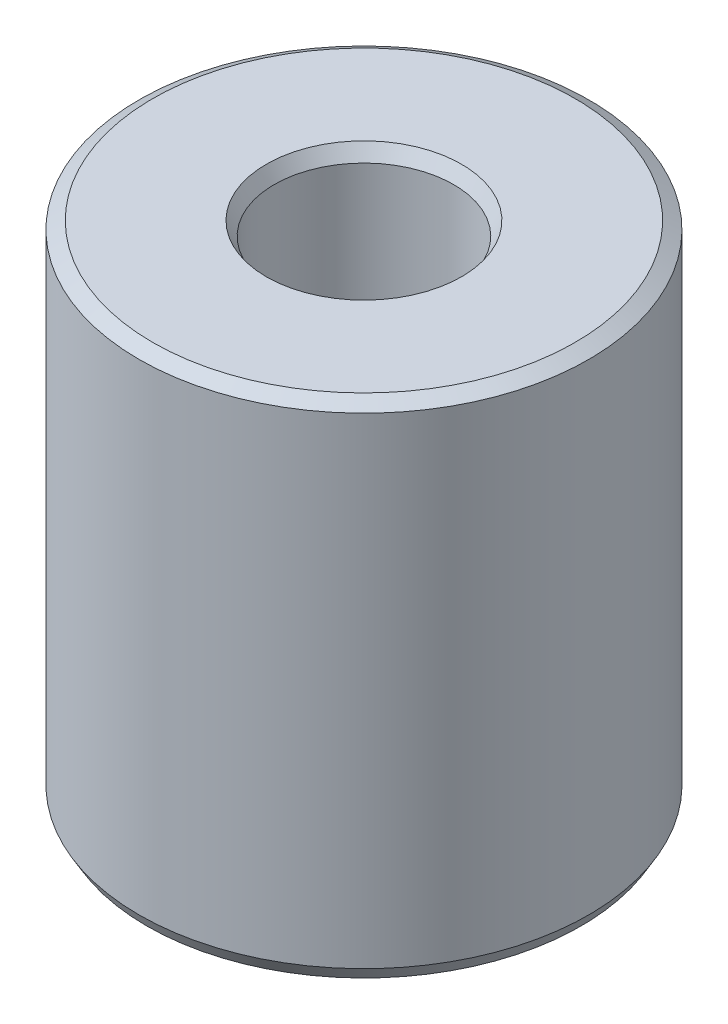
from build123d import *
from OCP.BRepFilletAPI import BRepFilletAPI_MakeChamfer

# Parameters (mm, degrees)
SKETCH1_R           = 57.5
BOSS_EXTRUDE1_DEPTH = 128.516499361
SKETCH2_R           = 22.933514178
CUT_EXTRUDE1_DEPTH  = 153.08218373
CHAMFER1_SIZE       = 2.01628121
CHAMFER1_SIZE2      = 3.492301499


with BuildPart() as part:
    # Sketch1 → Boss-Extrude1 (new body)
    with BuildSketch(Plane(origin=(0, 0, 0), x_dir=(1, 0, 0), z_dir=(0, 1, 0))):
        Circle(SKETCH1_R)
    extrude(amount=BOSS_EXTRUDE1_DEPTH)

    # Sketch2 → Cut-Extrude1 (cut, through all)
    with BuildSketch(Plane(origin=(0, 0, 0), x_dir=(1, 0, 0), z_dir=(0, 1, 0))):
        Circle(SKETCH2_R)
    extrude(amount=CUT_EXTRUDE1_DEPTH, mode=Mode.SUBTRACT)

    # Chamfer1: one chamfer whose edges measure the first distance from different faces: ONE call of the kernel's chamfer builder (chamfer() names one face for all edges)
    chamfer1_edges_1 = [part.edges().sort_by_distance(p)[0] for p in [
        (-22.933514178, 128.516499361, 0),
    ]]
    chamfer1_side_1 = [part.faces().sort_by_distance(p)[0] for p in [
        (-55.873654403, 128.516499361, 0),
    ]]
    chamfer1_edges_2 = [part.edges().sort_by_distance(p)[0] for p in [
        (-22.933514178, 0, 0),
    ]]
    chamfer1_side_2 = [part.faces().sort_by_distance(p)[0] for p in [
        (-22.933514178, 64.25824968, 0),
    ]]
    chamfer1_edges_3 = [part.edges().sort_by_distance(p)[0] for p in [
        (-57.5, 0, 0),
    ]]
    chamfer1_side_3 = [part.faces().sort_by_distance(p)[0] for p in [
        (-55.873654403, 0, 0),
    ]]
    chamfer1_edges_4 = [part.edges().sort_by_distance(p)[0] for p in [
        (-57.5, 128.516499361, 0),
    ]]
    chamfer1_side_4 = [part.faces().sort_by_distance(p)[0] for p in [
        (-57.5, 64.25824968, 0),
    ]]
    chamfer1 = BRepFilletAPI_MakeChamfer(part.part.solid().wrapped)
    for e in chamfer1_edges_1:
        chamfer1.Add(CHAMFER1_SIZE, CHAMFER1_SIZE2, e.wrapped, chamfer1_side_1[0].wrapped)  # the first distance lies on this face
    for e in chamfer1_edges_2:
        chamfer1.Add(CHAMFER1_SIZE, CHAMFER1_SIZE2, e.wrapped, chamfer1_side_2[0].wrapped)  # the first distance lies on this face
    for e in chamfer1_edges_3:
        chamfer1.Add(CHAMFER1_SIZE, CHAMFER1_SIZE2, e.wrapped, chamfer1_side_3[0].wrapped)  # the first distance lies on this face
    for e in chamfer1_edges_4:
        chamfer1.Add(CHAMFER1_SIZE, CHAMFER1_SIZE2, e.wrapped, chamfer1_side_4[0].wrapped)  # the first distance lies on this face
    add(Compound.cast(chamfer1.Shape()), mode=Mode.REPLACE)


solid = part.part
